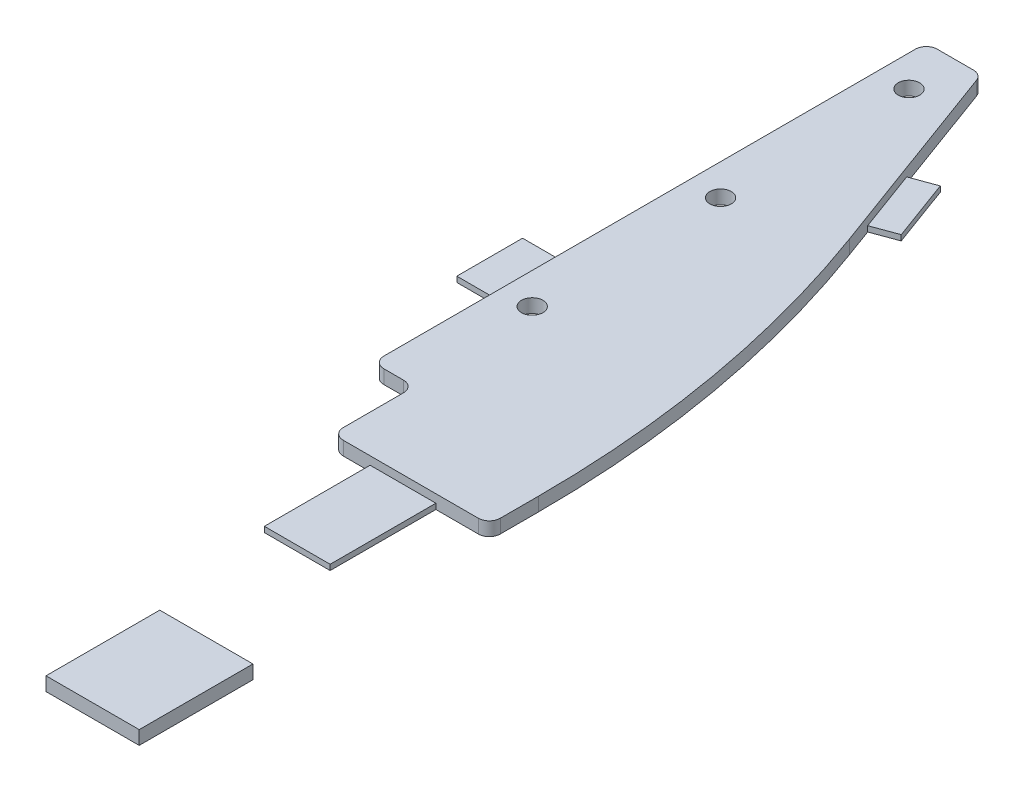
from build123d import *

# Parameters (mm, degrees)
BASE_FLANGE1_DEPTH  = 3.175
FILLET1_R           = 2.54
SKETCH9_R           = 2.4892
CUT_EXTRUDE1_DEPTH  = 259.776329385
SKETCH10_W          = 21.601588443
SKETCH10_H          = 26.357827305
BOSS_EXTRUDE1_DEPTH = 3.175
SKETCH11_W          = 15.24
SKETCH11_H          = 24.506960717
SKETCH11_W_2        = 9.488699203
SKETCH11_H_2        = 15.24
BOSS_EXTRUDE2_DEPTH = 1.27


# Sheet-metal steps are written as plain solids
with BuildPart() as part:
    # Sketch1 → Base-Flange1 (new body)
    with BuildSketch(Plane(origin=(0, 0, 0), x_dir=(1, 0, 0), z_dir=(0, 1, 0))):
        with BuildLine():
            Line((-203.073, 0), (-166.6875, 0))
            Line((-166.6875, 0), (-166.6875, 11.43))
            ThreePointArc((-166.6875, 11.43), (-170.61814947, 55.942020012), (-182.288444296, 99.07639319))
            Line((-182.288444296, 99.07639319), (-200.025, 147.32))
            Line((-200.025, 147.32), (-212.725, 147.32))
            Line((-212.725, 147.32), (-212.725, 19.05))
            Line((-212.725, 19.05), (-203.073, 19.05))
            Line((-203.073, 19.05), (-203.073, 0))
        make_face()
    extrude(amount=-BASE_FLANGE1_DEPTH)

    # Fillet1
    fillet1_edges = [part.edges().sort_by_distance(p)[0] for p in [
        (-166.6875, -1.5875, 0),
        (-203.073, -1.5875, 0),
        (-203.073, -1.5875, -19.05),
        (-212.725, -1.5875, -19.05),
        (-212.725, -1.5875, -147.32),
        (-200.025, -1.5875, -147.32),
    ]]
    fillet(fillet1_edges, radius=FILLET1_R)

    # Sketch9 → Cut-Extrude1 (cut, through all)
    with BuildSketch(Plane(origin=(0, 0, 0), x_dir=(1, 0, 0), z_dir=(0, 1, 0))):
        with Locations(Location((-205.486, 48.73625, 0), (0, 0, 270))):
            Circle(SKETCH9_R)
        with Locations(Location((-205.486, 92.3925, 0), (0, 0, 270))):
            Circle(SKETCH9_R)
        with Locations(Location((-205.486, 136.04875, 0), (0, 0, 270))):
            Circle(SKETCH9_R)
    extrude(amount=-CUT_EXTRUDE1_DEPTH, mode=Mode.SUBTRACT)

    # Sketch11 → Boss-Extrude2 (add)
    with BuildSketch(Plane.XZ.offset(3.175)):
        with Locations((-186.687788789, 12.253480359)):
            Rectangle(SKETCH11_W, SKETCH11_H)
        with Locations((-217.469349602, -55.613441741)):
            Rectangle(SKETCH11_W_2, SKETCH11_H_2)
        Polygon((-184.736614771, -105.73544108), (-189.995398363, -120.039384422), (-184.304516727, -122.131612715), (-179.045733136, -107.827669373), align=None)
    extrude(amount=-BOSS_EXTRUDE2_DEPTH)


with BuildPart() as body_2:
    # Sketch10 → Boss-Extrude1 (new body)
    with BuildSketch(Plane(origin=(0, 0, 0), x_dir=(1, 0, 0), z_dir=(0, 1, 0))):
        with Locations((-176.900603012, -68.541829584)):
            Rectangle(SKETCH10_W, SKETCH10_H)
    extrude(amount=-BOSS_EXTRUDE1_DEPTH)


solid = Compound([part.part, body_2.part])
